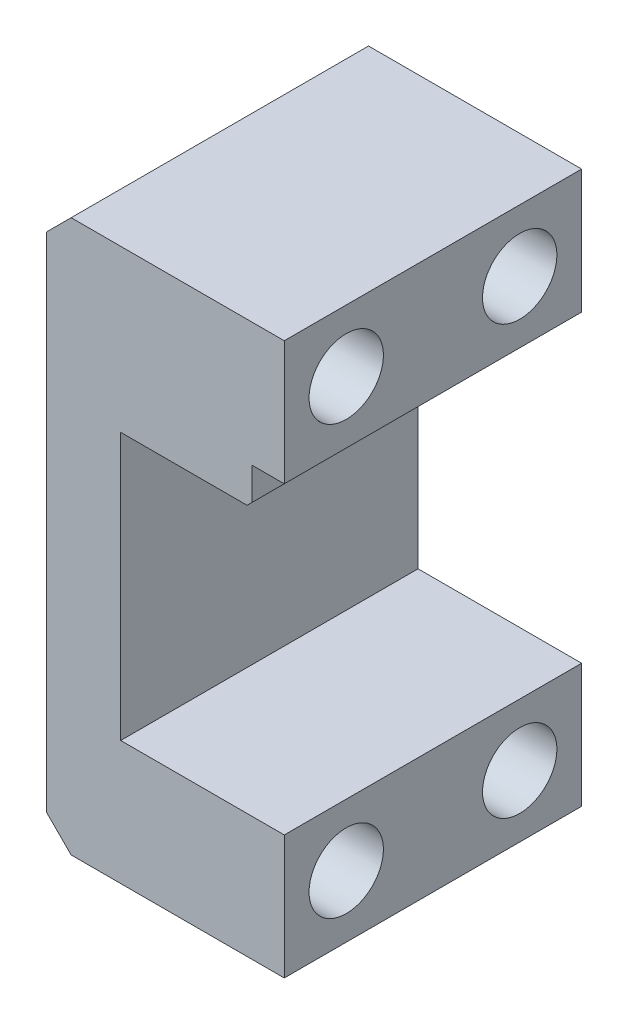
from build123d import *

# Parameters (mm, degrees)
EXTRUDE_1_DEPTH     = 12
CHAMFER_1_SIZE      = 0.2
SKETCH_2_R          = 1.5
CUT_EXTRUDE_1_DEPTH = 28.057584889
CHAMFER_2_SIZE      = 1


with BuildPart() as part:
    # 草图1 → 凸台-拉伸1 (new body)
    with BuildSketch(Plane.XY):
        Polygon((0, 0), (0, 22.27), (9.6, 22.27), (9.6, 17.27), (8.3, 17.27), (8.3, 15.77), (3, 15.77), (3, 5), (9.6, 5), (9.6, 0), align=None)
    extrude(amount=EXTRUDE_1_DEPTH)

    # 倒角1
    chamfer_1_edges = [part.edges().sort_by_distance(p)[0] for p in [
        (8.3, 15.77, 6),
    ]]
    chamfer(chamfer_1_edges, length=CHAMFER_1_SIZE)

    # 草图2 → 切除-拉伸1 (cut, through all)
    with BuildSketch(Plane.ZY):
        with Locations((9.5, 19.77)):
            Circle(SKETCH_2_R)
        with Locations((2.5, 19.77)):
            Circle(SKETCH_2_R)
        with Locations((2.5, 2.5)):
            Circle(SKETCH_2_R)
        with Locations((9.5, 2.5)):
            Circle(SKETCH_2_R)
    extrude(amount=-CUT_EXTRUDE_1_DEPTH, mode=Mode.SUBTRACT)

    # 倒角2
    chamfer_2_edges = [part.edges().sort_by_distance(p)[0] for p in [
        (0, 0, 6),
        (0, 22.27, 6),
    ]]
    chamfer(chamfer_2_edges, length=CHAMFER_2_SIZE - 0.0001)  # a hair under: the kernel refuses the full size


solid = part.part
